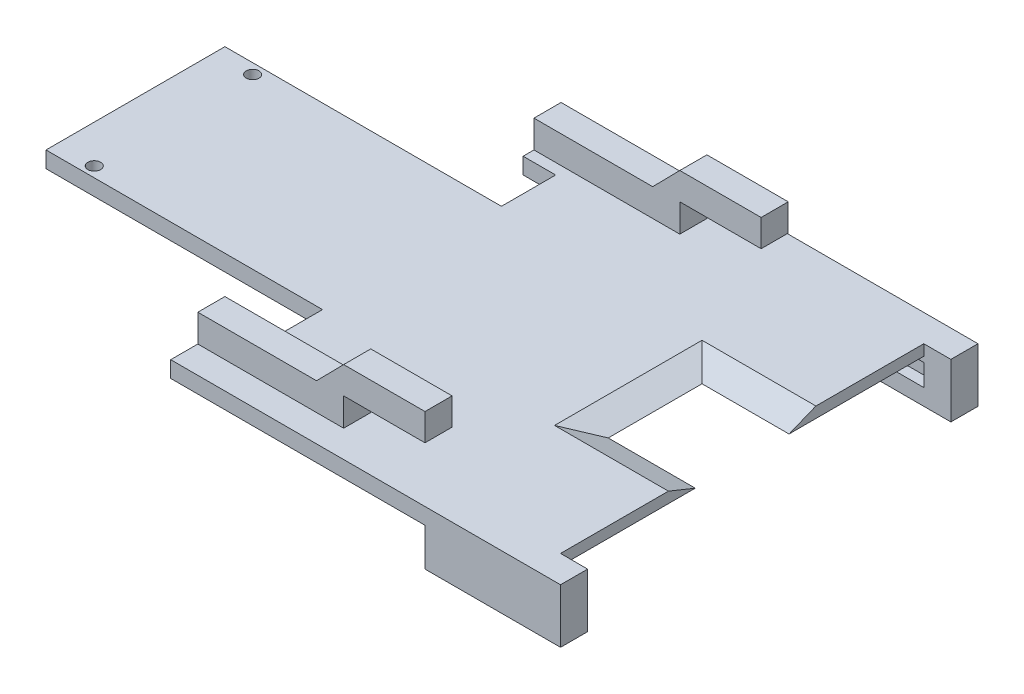
from build123d import *

# Parameters (mm, degrees)
SKETCH1_W                = 31.75
SKETCH1_H                = 12.7
BOSS_EXTRUDE1_DEPTH      = 6.35
SKETCH3_W                = 25.4
SKETCH3_H                = 5.08
CUT_EXTRUDE1_DEPTH       = 2.54
BOSS_EXTRUDE2_DEPTH      = 3.81
SKETCH5_W                = 31.75
SKETCH5_H                = 6.35
BOSS_EXTRUDE3_DEPTH      = 8.89
SKETCH6_W                = 25.4
SKETCH6_H                = 5.08
CUT_EXTRUDE2_DEPTH       = 2.54
SKETCH9_W                = 6.35
SKETCH9_H                = 3.81
BOSS_EXTRUDE5_DEPTH      = 6.35
SKETCH10_W               = 6.35
SKETCH10_H               = 6.35
BOSS_EXTRUDE6_DEPTH      = 12.9159
SKETCH12_W               = 6.35
SKETCH12_H               = 3.81
BOSS_EXTRUDE8_DEPTH      = 6.35
SKETCH14_W               = 6.35
SKETCH14_H               = 6.35
BOSS_EXTRUDE11_DEPTH     = 19.05
CUT_EXTRUDE9_DEPTH       = 101.12747092
SKETCH19_W               = 72.39
SKETCH19_H               = 3.81
BOSS_EXTRUDE12_DEPTH     = 34.163
BOSS_EXTRUDE13_DEPTH     = 27.813
SKETCH21_W               = 12.7
SKETCH21_H               = 3.81
CUT_EXTRUDE10_DEPTH      = 7.62
SKETCH22_W               = 41.91
SKETCH22_H               = 3.81
BOSS_EXTRUDE14_DEPTH     = 50.8
SKETCH23_W               = 85.09
SKETCH23_H               = 3.81
BOSS_EXTRUDE15_DEPTH     = 44.45
SKETCH24_R               = 1.5
CUT_EXTRUDE11_DEPTH      = 149.400241239
SKETCH25_W               = 41.91
SKETCH25_H               = 3.81
BOSS_EXTRUDE16_DEPTH     = 6.35
CUT_EXTRUDE12_DEPTH      = 154.181474728
CUT_EXTRUDE12_DEPTH_BACK = 154.181474728
CUT_EXTRUDE13_DEPTH      = 1.27
CHAMFER1_SIZE            = 6.35
CHAMFER1_SIZE_2          = 2.565566534


with BuildPart() as part:
    # Sketch1 → Boss-Extrude1 (new body)
    with BuildSketch(Plane.XY):
        with Locations((15.875, 6.35)):
            Rectangle(SKETCH1_W, SKETCH1_H)
    extrude(amount=BOSS_EXTRUDE1_DEPTH)

    # Sketch3 → Cut-Extrude1 (cut)
    with BuildSketch(Plane.XY.offset(6.35)):
        with Locations((12.7, 6.35)):
            Rectangle(SKETCH3_W, SKETCH3_H)
    extrude(amount=-CUT_EXTRUDE1_DEPTH, mode=Mode.SUBTRACT)

    # Sketch4 → Boss-Extrude2 (add)
    with BuildSketch(Plane(origin=(0, 12.7, 0), x_dir=(1, 0, 0), z_dir=(0, 1, 0))):
        Polygon((0, 0), (-25.4, 0), (-25.4, -97.79), (31.75, -97.79), (31.75, -91.44), (-19.05, -91.44), (-19.05, -6.35), (0, -6.35), align=None)
    extrude(amount=-BOSS_EXTRUDE2_DEPTH)

    # Sketch5 → Boss-Extrude3 (add)
    with BuildSketch(Plane.XZ.offset(-8.89)):
        with Locations((15.875, 94.615)):
            Rectangle(SKETCH5_W, SKETCH5_H)
    extrude(amount=BOSS_EXTRUDE3_DEPTH)

    # Sketch6 → Cut-Extrude2 (cut)
    with BuildSketch(Plane(origin=(0, 0, 91.44), x_dir=(-1, 0, 0), z_dir=(0, 0, -1))):
        with Locations((-12.7, 6.35)):
            Rectangle(SKETCH6_W, SKETCH6_H)
    extrude(amount=-CUT_EXTRUDE2_DEPTH, mode=Mode.SUBTRACT)

    # Sketch9 → Boss-Extrude5 (add)
    with BuildSketch(Plane.ZY.offset(25.4)):
        with Locations((88.265, 10.795)):
            Rectangle(SKETCH9_W, SKETCH9_H)
        with Locations((9.525, 10.795)):
            Rectangle(SKETCH9_W, SKETCH9_H)
    extrude(amount=BOSS_EXTRUDE5_DEPTH)

    # Sketch10 → Boss-Extrude6 (add)
    with BuildSketch(Plane(origin=(0, 12.7, 0), x_dir=(1, 0, 0), z_dir=(0, 1, 0))):
        with Locations((-28.575, -88.265)):
            Rectangle(SKETCH10_W, SKETCH10_H)
        with Locations((-28.575, -9.525)):
            Rectangle(SKETCH10_W, SKETCH10_H)
    extrude(amount=BOSS_EXTRUDE6_DEPTH)

    # Sketch12 → Boss-Extrude8 (add)
    with BuildSketch(Plane.ZY.offset(25.4)):
        with Locations((94.615, 10.795)):
            Rectangle(SKETCH12_W, SKETCH12_H)
        with Locations((3.175, 10.795)):
            Rectangle(SKETCH12_W, SKETCH12_H)
    extrude(amount=BOSS_EXTRUDE8_DEPTH)

    # Sketch14 → Boss-Extrude11 (add)
    with BuildSketch(Plane(origin=(-25.4, 0, 0), x_dir=(0, 0, -1), z_dir=(1, 0, 0))):
        with Locations((-88.265, 22.4409)):
            Rectangle(SKETCH14_W, SKETCH14_H)
        with Locations((-9.525, 22.4409)):
            Rectangle(SKETCH14_W, SKETCH14_H)
    extrude(amount=BOSS_EXTRUDE11_DEPTH)

    # Sketch18 → Cut-Extrude9 (cut, through all)
    with BuildSketch(Plane.XY.offset(91.44)):
        Polygon((-31.75, 19.15795), (-25.4, 25.6159), (-31.75, 25.6159), align=None)
    extrude(amount=-CUT_EXTRUDE9_DEPTH, mode=Mode.SUBTRACT)

    # Sketch19 → Boss-Extrude12 (add)
    with BuildSketch(Plane.ZY.offset(25.4)):
        with Locations((48.895, 10.795)):
            Rectangle(SKETCH19_W, SKETCH19_H)
    extrude(amount=BOSS_EXTRUDE12_DEPTH)

    # Sketch20 → Boss-Extrude13 (add)
    with BuildSketch(Plane.ZY.offset(31.75)):
        Polygon((0, 8.89), (0, 12.7), (6.35, 12.7), (6.35, 19.15795), (12.7, 19.15795), (12.7, 8.89), align=None)
        Polygon((85.09, 19.15795), (91.44, 19.15795), (91.44, 12.7), (97.79, 12.7), (97.79, 8.89), (85.09, 8.89), align=None)
    extrude(amount=BOSS_EXTRUDE13_DEPTH)

    # Sketch21 → Cut-Extrude10 (cut)
    with BuildSketch(Plane.ZY.offset(59.563)):
        with Locations((21.59, 10.795)):
            Rectangle(SKETCH21_W, SKETCH21_H)
        with Locations((76.2, 10.795)):
            Rectangle(SKETCH21_W, SKETCH21_H)
    extrude(amount=-CUT_EXTRUDE10_DEPTH, mode=Mode.SUBTRACT)

    # Sketch22 → Boss-Extrude14 (add)
    with BuildSketch(Plane.ZY.offset(59.563)):
        with Locations((48.895, 10.795)):
            Rectangle(SKETCH22_W, SKETCH22_H)
    extrude(amount=BOSS_EXTRUDE14_DEPTH)

    # Sketch23 → Boss-Extrude15 (add)
    with BuildSketch(Plane(origin=(-19.05, 0, 0), x_dir=(0, 0, -1), z_dir=(1, 0, 0))):
        with Locations((-48.895, 10.795)):
            Rectangle(SKETCH23_W, SKETCH23_H)
    extrude(amount=BOSS_EXTRUDE15_DEPTH)

    # Sketch24 → Cut-Extrude11 (cut, through all)
    with BuildSketch(Plane.XZ.offset(-8.89)):
        with Locations(Location((-107.823, 30.353, 0), (0, 0, 270))):
            Circle(SKETCH24_R)
        with Locations(Location((-107.823, 67.437, 0), (0, 0, 270))):
            Circle(SKETCH24_R)
    extrude(amount=-CUT_EXTRUDE11_DEPTH, mode=Mode.SUBTRACT)

    # Sketch25 → Boss-Extrude16 (add)
    with BuildSketch(Plane.ZY.offset(110.363)):
        with Locations((48.895, 10.795)):
            Rectangle(SKETCH25_W, SKETCH25_H)
    extrude(amount=BOSS_EXTRUDE16_DEPTH)

    # Sketch26 → Cut-Extrude12 (cut, two sides: drawn at the far end of the back side and taken through both)
    with BuildSketch(Plane.XZ.offset(-8.89).offset(-CUT_EXTRUDE12_DEPTH_BACK)):
        Polygon((25.4, 37.973), (25.4, 48.895), (25.4, 59.817), (5.08, 59.817), (5.08, 37.973), align=None)
    extrude(amount=CUT_EXTRUDE12_DEPTH + CUT_EXTRUDE12_DEPTH_BACK, mode=Mode.SUBTRACT)

    # Sketch27 → Cut-Extrude13 (cut)
    with BuildSketch(Plane.XZ.offset(-8.89)):
        Polygon((25.4, 37.973), (25.4, 6.35), (-38.1, 6.35), (-38.1, 91.44), (25.4, 91.44), (25.4, 59.817), (5.08, 59.817), (5.08, 37.973), align=None)
    extrude(amount=-CUT_EXTRUDE13_DEPTH, mode=Mode.SUBTRACT)

    # Chamfer1
    # the kernel refuses this chamfer: 6.35, 2.565566534 mm, written as the material it takes off along each edge
    with BuildSketch(Plane(origin=(5.08, 12.7, 59.817), x_dir=(0, 0.014446902557764131, 0.9998956380575357), z_dir=(1, 0, 0)), Plane(origin=(41.865480117, 12.7, 37.973), x_dir=(0, 0.014446902557764124, -0.9998956380575357), z_dir=(-1, 0, 0))) as chamfer1_piece_1:
        Polygon((CHAMFER1_SIZE * 0.999895638058, CHAMFER1_SIZE * 0.0144469025578), (-CHAMFER1_SIZE_2 * 0.0144469025581, CHAMFER1_SIZE_2 * 0.999895638078), (0, 0), align=None)
    extrude(amount=36.785480117, mode=Mode.SUBTRACT)
    with BuildSketch(Plane(origin=(5.08, 12.7, 37.973), x_dir=(-0.9998956380575357, 0.01444690255776412, 0), z_dir=(0, 0, 1))) as chamfer1_piece_2:
        Polygon((CHAMFER1_SIZE * 0.999895638058, CHAMFER1_SIZE * 0.0144469025578), (-CHAMFER1_SIZE_2 * 0.0144469025581, CHAMFER1_SIZE_2 * 0.999895638078), (0, 0), align=None)
    extrude(amount=21.844, mode=Mode.SUBTRACT)
    with BuildSketch(Plane(origin=(-11.385480117, 12.7, 59.817), x_dir=(0, 0.014446902557764131, 0.9998956380575357), z_dir=(1, 0, 0))) as chamfer1_piece_3a_section:
        Polygon((CHAMFER1_SIZE * 0.999895638058, CHAMFER1_SIZE * 0.0144469025578), (-CHAMFER1_SIZE_2 * 0.0144469025581, CHAMFER1_SIZE_2 * 0.999895638078), (0, 0), align=None)
    chamfer1_piece_3a = extrude(amount=53.250960234, mode=Mode.PRIVATE)
    chamfer1_piece_3a = split(chamfer1_piece_3a, bisect_by=Plane(origin=(5.08, 11.901985968, 61.978678206), z_dir=(-1, 0, 0)), keep=Keep.TOP, mode=Mode.PRIVATE)
    with BuildSketch(Plane(origin=(5.08, 12.7, 37.973), x_dir=(-0.9998956380575357, 0.01444690255776412, 0), z_dir=(0, 0, 1))) as chamfer1_piece_3b_section:
        Polygon((CHAMFER1_SIZE * 0.999895638058, CHAMFER1_SIZE * 0.0144469025578), (-CHAMFER1_SIZE_2 * 0.0144469025581, CHAMFER1_SIZE_2 * 0.999895638078), (0, 0), align=None)
    chamfer1_piece_3b = extrude(amount=38.309480117, mode=Mode.PRIVATE)
    chamfer1_piece_3b = split(chamfer1_piece_3b, bisect_by=Plane(origin=(2.918321794, 11.901985968, 59.817), z_dir=(0, 0, 1)), keep=Keep.TOP, mode=Mode.PRIVATE)
    chamfer1_piece_3 = chamfer1_piece_3a & chamfer1_piece_3b
    add(chamfer1_piece_3, mode=Mode.SUBTRACT)
    with BuildSketch(Plane(origin=(5.08, 12.7, 21.507519883), x_dir=(-0.9998956380575357, 0.01444690255776412, 0), z_dir=(0, 0, 1))) as chamfer1_piece_4a_section:
        Polygon((CHAMFER1_SIZE * 0.999895638058, CHAMFER1_SIZE * 0.0144469025578), (-CHAMFER1_SIZE_2 * 0.0144469025581, CHAMFER1_SIZE_2 * 0.999895638078), (0, 0), align=None)
    chamfer1_piece_4a = extrude(amount=38.309480117, mode=Mode.PRIVATE)
    chamfer1_piece_4a = split(chamfer1_piece_4a, bisect_by=Plane(origin=(2.918321794, 11.901985968, 37.973), z_dir=(0, 0, -1)), keep=Keep.TOP, mode=Mode.PRIVATE)
    with BuildSketch(Plane(origin=(41.865480117, 12.7, 37.973), x_dir=(0, 0.014446902557764124, -0.9998956380575357), z_dir=(-1, 0, 0))) as chamfer1_piece_4b_section:
        Polygon((CHAMFER1_SIZE * 0.999895638058, CHAMFER1_SIZE * 0.0144469025578), (-CHAMFER1_SIZE_2 * 0.0144469025581, CHAMFER1_SIZE_2 * 0.999895638078), (0, 0), align=None)
    chamfer1_piece_4b = extrude(amount=53.250960234, mode=Mode.PRIVATE)
    chamfer1_piece_4b = split(chamfer1_piece_4b, bisect_by=Plane(origin=(5.08, 11.901985968, 35.811321794), z_dir=(-1, 0, 0)), keep=Keep.TOP, mode=Mode.PRIVATE)
    chamfer1_piece_4 = chamfer1_piece_4a & chamfer1_piece_4b
    add(chamfer1_piece_4, mode=Mode.SUBTRACT)


solid = part.part
